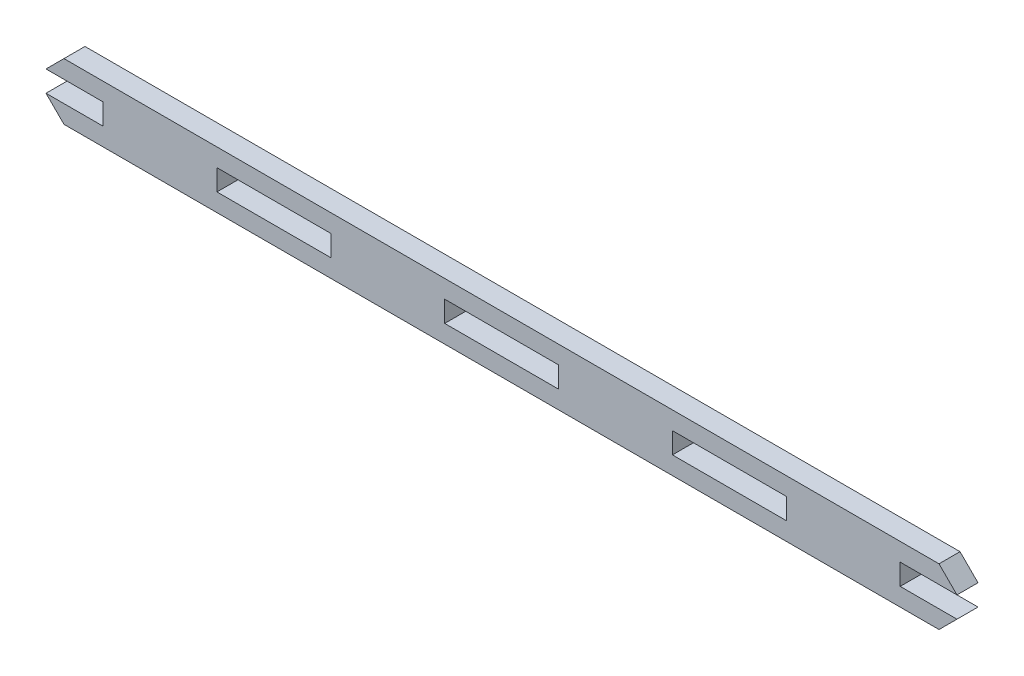
from build123d import *

# Parameters (mm, degrees)
SKETCH2_W           = 30
SKETCH2_H           = 5.54
BOSS_EXTRUDE1_DEPTH = 5.54


with BuildPart() as part:
    # Sketch2 → Boss-Extrude1 (new body)
    with BuildSketch(Plane.XY):
        Polygon((55.613682838, 15.146039761), (286.153682838, 15.146039761), (290.883682838, 10.416039761), (275.922330423, 10.416039761), (275.922330423, 4.876039761), (290.883682838, 4.876039761), (286.153682838, 0.146039761), (55.613682838, 0.146039761), (50.883682838, 4.876039761), (65.922330423, 4.876039761), (65.922330423, 10.416039761), (50.883682838, 10.416039761), align=None)
        with Locations((230.922330423, 7.646039761)):
            Rectangle(SKETCH2_W, SKETCH2_H, mode=Mode.SUBTRACT)
        with Locations((170.922330423, 7.646039761)):
            Rectangle(SKETCH2_W, SKETCH2_H, mode=Mode.SUBTRACT)
        with Locations((110.922330423, 7.646039761)):
            Rectangle(SKETCH2_W, SKETCH2_H, mode=Mode.SUBTRACT)
    extrude(amount=BOSS_EXTRUDE1_DEPTH)


solid = part.part
